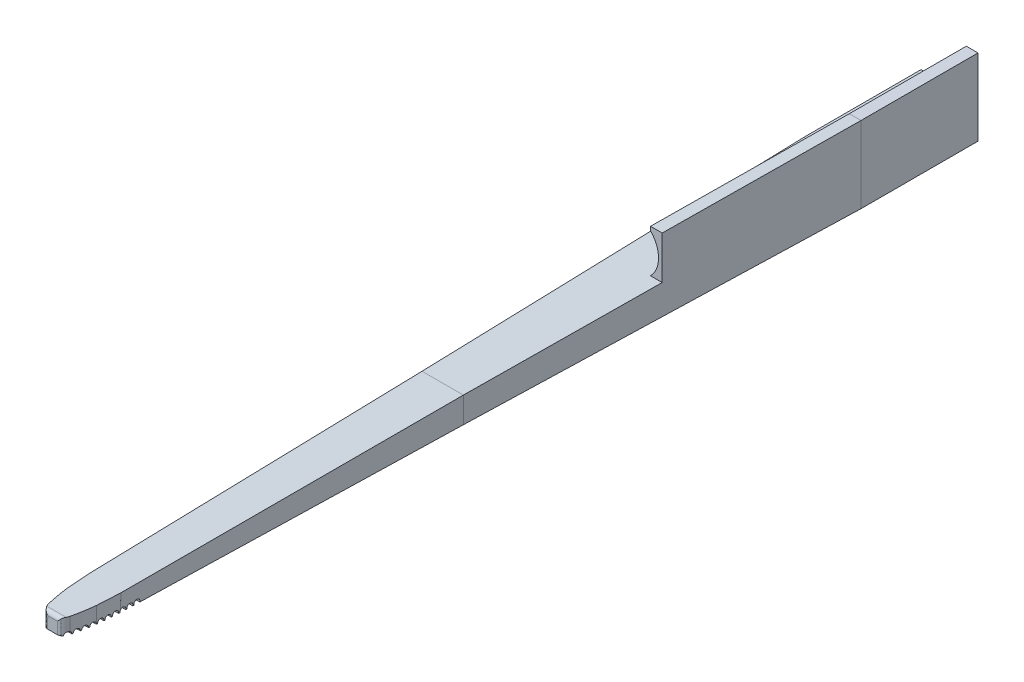
from build123d import *

# Parameters (mm, degrees)
SKETCH7_R               = 0.75
CUT_EXTRUDE1_DEPTH      = 10
CUT_EXTRUDE5_DEPTH      = 10
FILLET1_R               = 1
CUT_EXTRUDE6_DEPTH      = 7
CUT_EXTRUDE6_DEPTH_BACK = 10
BOSS_EXTRUDE1_DEPTH     = 30


with BuildPart() as part:
    # Sketch6 → Loft4 section 0
    with BuildSketch(Plane.XY.offset(60)):
        with BuildLine():
            Line((-11.324810891, 40.030640284), (-21.924810891, 40.030640284))
            Line((-21.924810891, 40.030640284), (-21.924810891, 33.430640284))
            Line((-21.924810891, 33.430640284), (-11.324810891, 33.430640284))
            Line((-11.324810891, 33.430640284), (-11.324810891, 40.030640284))
        make_face()
    # Sketch3 → Loft4 section 1
    with BuildSketch(Plane.XY.offset(160)):
        with BuildLine():
            Line((-20.624810891, 34.730640284), (-12.624810891, 34.730640284))
            Line((-12.624810891, 34.730640284), (-12.624810891, 38.730640284))
            Line((-12.624810891, 38.730640284), (-20.624810891, 38.730640284))
            Line((-20.624810891, 38.730640284), (-20.624810891, 34.730640284))
        make_face()
    loft()

    # Sketch7 → Cut-Extrude1 (cut)
    with BuildSketch(Plane(origin=(-22.700974427, 0, 0.295112668), x_dir=(0.012998901639219624, 0, 0.9999155107088669), z_dir=(-0.9999155107088669, -1.387661528336007e-14, 0.012998901639219624))):
        with Locations((158.470573428, 34.714420145)):
            Circle(SKETCH7_R)
        with Locations((156.692573428, 34.714420145)):
            Circle(SKETCH7_R)
        with Locations((154.914573428, 34.714420145)):
            Circle(SKETCH7_R)
        with Locations((153.136573428, 34.714420145)):
            Circle(SKETCH7_R)
        with Locations((151.358573428, 34.714420145)):
            Circle(SKETCH7_R)
        with Locations((149.580573428, 34.714420145)):
            Circle(SKETCH7_R)
        with Locations((147.802573428, 34.714420145)):
            Circle(SKETCH7_R)
        with Locations((146.024573428, 34.714420145)):
            Circle(SKETCH7_R)
        with Locations((144.246573428, 34.714420145)):
            Circle(SKETCH7_R)
        with Locations((142.468573428, 34.714420145)):
            Circle(SKETCH7_R)
    extrude(amount=-CUT_EXTRUDE1_DEPTH, mode=Mode.SUBTRACT)

    # Sketch8 → Cut-Extrude5 (cut)
    with BuildSketch(Plane(origin=(0, 32.645123258, -0.424386602), x_dir=(1, 0, 0), z_dir=(3.469153820840017e-15, -0.999915510708867, 0.012998901639208658))):
        with BuildLine():
            Line((-22.278712112, 147.211544635), (-20.796721293, 147.211544635))
            Line((-20.796721293, 147.211544635), (-20.425715707, 152.990711246))
            ThreePointArc((-20.425715707, 152.990711246), (-20.018857007, 155.85907681), (-19.465866269, 158.702886974))
            ThreePointArc((-19.465866269, 158.702886974), (-16.706451749, 160.940898623), (-13.90406292, 158.756938576))
            ThreePointArc((-13.90406292, 158.756938576), (-13.299107073, 155.905544502), (-12.854746239, 153.024752389))
            Line((-12.854746239, 153.024752389), (-12.452902246, 147.211544635))
            Line((-12.452902246, 147.211544635), (-11.078712112, 147.211544635))
            Line((-11.078712112, 147.211544635), (-11.078712112, 168.961544635))
            Line((-11.078712112, 168.961544635), (-22.278712112, 168.961544635))
            Line((-22.278712112, 168.961544635), (-22.278712112, 147.211544635))
        make_face()
        with BuildLine():
            Line((-22.278712112, 147.211544635), (-20.796721293, 147.211544635))
            Line((-20.796721293, 147.211544635), (-20.425715707, 152.990711246))
            ThreePointArc((-20.425715707, 152.990711246), (-20.018857007, 155.85907681), (-19.465866269, 158.702886974))
            ThreePointArc((-19.465866269, 158.702886974), (-16.706451749, 160.940898623), (-13.90406292, 158.756938576))
            ThreePointArc((-13.90406292, 158.756938576), (-13.299107073, 155.905544502), (-12.854746239, 153.024752389))
            Line((-12.854746239, 153.024752389), (-12.452902246, 147.211544635))
            Line((-12.452902246, 147.211544635), (-11.078712112, 147.211544635))
            Line((-11.078712112, 147.211544635), (-11.078712112, 168.961544635))
            Line((-11.078712112, 168.961544635), (-22.278712112, 168.961544635))
            Line((-22.278712112, 168.961544635), (-22.278712112, 147.211544635))
        make_face()
        with BuildLine():
            Line((-22.278712112, 147.211544635), (-20.796721293, 147.211544635))
            Line((-20.796721293, 147.211544635), (-20.425715707, 152.990711246))
            ThreePointArc((-20.425715707, 152.990711246), (-20.018857007, 155.85907681), (-19.465866269, 158.702886974))
            ThreePointArc((-19.465866269, 158.702886974), (-16.706451749, 160.940898623), (-13.90406292, 158.756938576))
            ThreePointArc((-13.90406292, 158.756938576), (-13.299107073, 155.905544502), (-12.854746239, 153.024752389))
            Line((-12.854746239, 153.024752389), (-12.452902246, 147.211544635))
            Line((-12.452902246, 147.211544635), (-11.078712112, 147.211544635))
            Line((-11.078712112, 147.211544635), (-11.078712112, 168.961544635))
            Line((-11.078712112, 168.961544635), (-22.278712112, 168.961544635))
            Line((-22.278712112, 168.961544635), (-22.278712112, 147.211544635))
        make_face()
    extrude(amount=-CUT_EXTRUDE5_DEPTH, mode=Mode.SUBTRACT)

    # Fillet1
    fillet1_edges = [part.edges().sort_by_distance(p)[0] for p in [
        (-16.678712112, 38.730640284, 160),
        (-15.098807664, 36.730653957, 160),
        (-18.25861656, 36.730653957, 160),
    ]]
    fillet(fillet1_edges, radius=FILLET1_R)

    # Loft5: read off the stored shape, not the designer's step
    # Loft5: loft between two sections, ruled curve by curve
    loft5_from = [
        Edge.make_line((-23.924810891, 41.030640284, -40), (-23.924810891, 32.430640284, -40)),
        Edge.make_line((-9.324810891, 41.030640284, -40), (-23.924810891, 41.030640284, -40)),
        Edge.make_line((-9.324810891, 32.430640284, -40), (-9.324810891, 41.030640284, -40)),
        Edge.make_line((-23.924810891, 32.430640284, -40), (-9.324810891, 32.430640284, -40)),
    ]
    loft5_to = [
        Edge.make_line((-21.924810891, 40.030640284, 60), (-21.924810891, 33.430640284, 60)),
        Edge.make_line((-11.324810891, 40.030640284, 60), (-21.924810891, 40.030640284, 60)),
        Edge.make_line((-11.324810891, 33.430640284, 60), (-11.324810891, 40.030640284, 60)),
        Edge.make_line((-21.924810891, 33.430640284, 60), (-11.324810891, 33.430640284, 60)),
    ]
    loft5 = Solid(Shell([*[Face.make_surface_from_curves(loft5_from[k], loft5_to[k]) for k in range(4)], Face(Wire(loft5_from)), Face(Wire(loft5_to))]))
    add(loft5)

    # Cut-Loft2: read off the stored shape, not the designer's step
    # Cut-Loft2: loft between two sections, ruled curve by curve
    cut_loft2_from = [
        Edge.make_line((-10.324810891, 40.030640284, -40), (-22.924810891, 40.030640284, -40)),
        Edge.make_line((-22.924810891, 40.030640284, -40), (-22.924810891, 33.430640284, -40)),
        Edge.make_line((-10.324810891, 33.430640284, -40), (-10.324810891, 40.030640284, -40)),
        Edge.make_line((-22.924810891, 33.430640284, -40), (-10.324810891, 33.430640284, -40)),
    ]
    cut_loft2_to = [
        Edge.make_line((-12.624810891, 38.730640284, 60), (-20.624810891, 38.730640284, 60)),
        Edge.make_line((-20.624810891, 38.730640284, 60), (-20.624810891, 34.730640284, 60)),
        Edge.make_line((-12.624810891, 34.730640284, 60), (-12.624810891, 38.730640284, 60)),
        Edge.make_line((-20.624810891, 34.730640284, 60), (-12.624810891, 34.730640284, 60)),
    ]
    cut_loft2 = Solid(Shell([*[Face.make_surface_from_curves(cut_loft2_from[k], cut_loft2_to[k]) for k in range(4)], Face(Wire(cut_loft2_from)), Face(Wire(cut_loft2_to))]))
    add(cut_loft2, mode=Mode.SUBTRACT)

    # Sweep2: sweep along a curve in space
    with BuildLine() as sweep2_path:
        Line((-9.324810891, 41.030640284, -40), (-10.324810891, 40.530640284, 10))
    # Sketch11 → Sweep2 (sweep)
    with BuildSketch(Plane(origin=(0, 0, -40), x_dir=(-1, 0, 0), z_dir=(0, 0, -1))):
        with BuildLine():
            Line((9.324810891, 41.030640284), (9.324810891, 52.030640284))
            Line((9.324810891, 52.030640284), (12.324810891, 52.030640284))
            Line((12.324810891, 52.030640284), (12.324810891, 51.030640284))
            ThreePointArc((12.324810891, 51.030640284), (10.25374308, 46.030640284), (12.324810891, 41.030640284))
            Line((12.324810891, 41.030640284), (9.324810891, 41.030640284))
        make_face()
    sweep(path=sweep2_path.line)

    # Sketch12 → Cut-Extrude6 (cut, two sides: drawn at the far end of the back side and taken through both)
    with BuildSketch(Plane(origin=(-21.993176501, 0, 0.50584306), x_dir=(-0.022993918912559353, 0, -0.9997356048941354), z_dir=(0.9997356048941354, 0, -0.022993918912559353)).offset(-CUT_EXTRUDE6_DEPTH_BACK)):
        Polygon((40.516555438, 40.030640284), (-59.509891064, 38.730640284), (-59.509891064, 34.730640284), (40.516555438, 33.430640284), align=None)
        Polygon((52.044107256, 40.030640284), (40.516555438, 40.030640284), (40.516555438, 33.430640284), (52.044107256, 31.77956442), align=None)
    extrude(amount=CUT_EXTRUDE6_DEPTH + CUT_EXTRUDE6_DEPTH_BACK, mode=Mode.SUBTRACT)

    # Sketch13 → Boss-Extrude1 (add)
    with BuildSketch(Plane(origin=(0, 0, -40), x_dir=(-1, 0, 0), z_dir=(0, 0, -1))):
        with BuildLine():
            Line((23.924810891, 32.430640284), (23.924810891, 33.427346895))
            Line((23.924810891, 33.427346895), (22.924810891, 33.430640284))
            Line((22.924810891, 33.430640284), (10.324810891, 33.430640284))
            Line((10.324810891, 33.430640284), (10.324810891, 40.030640284))
            Line((10.324810891, 40.030640284), (22.924810891, 40.030640284))
            Line((22.924810891, 40.030640284), (23.924810891, 40.030640284))
            Line((23.924810891, 40.030640284), (23.924810891, 41.030640284))
            Line((23.924810891, 41.030640284), (12.324810891, 41.030640284))
            ThreePointArc((12.324810891, 41.030640284), (10.25374308, 46.030640284), (12.324810891, 51.030640284))
            Line((12.324810891, 51.030640284), (12.324810891, 52.030640284))
            Line((12.324810891, 52.030640284), (9.324810891, 52.030640284))
            Line((9.324810891, 52.030640284), (9.324810891, 32.430640284))
            Line((9.324810891, 32.430640284), (23.924810891, 32.430640284))
        make_face()
    extrude(amount=BOSS_EXTRUDE1_DEPTH)


solid = part.part
